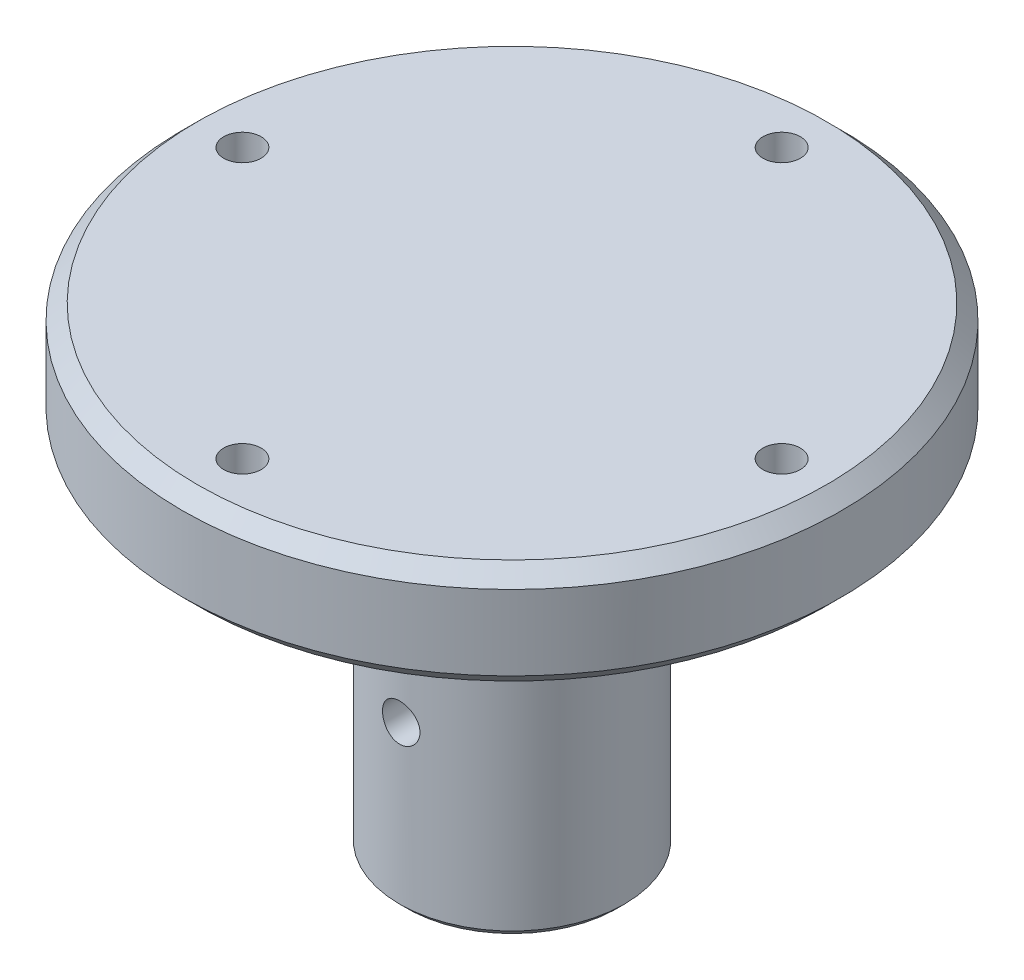
from build123d import *

# Parameters (mm, degrees)
SKETCH_5_R             = 7.5
SKETCH_5_R_2           = 5.25
EXTRUDE_1_DEPTH        = 3.5
SKETCH_6_R             = 1.25
CUT_EXTRUDE_M3_1_DEPTH = 42.856899073
CHAMFER_1_SIZE         = 0.5
CHAMFER_2_SIZE         = 1
CUT_EXTRUDE_14_DEPTH   = 3.5
FILLET_2_R             = 2.25
HOLE_WIZARD_M3_1_D     = 2.5


with BuildPart() as part:
    # 草图1 → 旋转1 (revolve)
    with BuildSketch(Plane(origin=(0, 0, 0), x_dir=(0, 0, -1), z_dir=(1, 0, 0))):
        Polygon((-7.5, 0), (-5.25, 0), (-5.25, 18), (0, 18), (0, 28), (-22, 28), (-22, 21), (-9, 21), (-9, 18), (-7.5, 18), align=None)
    revolve(axis=Axis((0, 28, 0), (0, -1, 0)))

    # 草图5 → 凸台-拉伸1 (add)
    with BuildSketch(Plane.XZ):
        with Locations(Location((0, 0, 0), (0, 0, 90))):
            Circle(SKETCH_5_R)
        with Locations(Location((0, 0, 0), (0, 0, 90))):
            Circle(SKETCH_5_R_2, mode=Mode.SUBTRACT)
    extrude(amount=EXTRUDE_1_DEPTH)

    # 草图6 → M3螺纹孔1 (cut, through all)
    with BuildSketch(Plane.XY):
        with Locations(Location((0, 7.5, 0), (0, 0, 270))):
            Circle(SKETCH_6_R)
    extrude(amount=CUT_EXTRUDE_M3_1_DEPTH, mode=Mode.SUBTRACT)

    # 倒角1
    chamfer_1_edges = [part.edges().sort_by_distance(p)[0] for p in [
        (0, -3.5, -7.5),
        (0, 18, -9),
    ]]
    chamfer(chamfer_1_edges, length=CHAMFER_1_SIZE)

    # 倒角2
    chamfer_2_edges = [part.edges().sort_by_distance(p)[0] for p in [
        (0, 28, -22),
        (0, 21, -22),
    ]]
    chamfer(chamfer_2_edges, length=CHAMFER_2_SIZE)

    # 草图8 → 切除-拉伸14 (cut)
    with BuildSketch(Plane.XZ.offset(-21)):
        with BuildLine():
            Line((-9.866772518, 3.591211505), (-14.095389312, 5.13030215))
            ThreePointArc((-14.095389312, 5.13030215), (0, -15), (14.095389312, 5.13030215))
            Line((14.095389312, 5.13030215), (9.866772518, 3.591211505))
            ThreePointArc((9.866772518, 3.591211505), (0, -10.5), (-9.866772518, 3.591211505))
        make_face()
    extrude(amount=-CUT_EXTRUDE_14_DEPTH, mode=Mode.SUBTRACT)

    # 圆角2
    fillet_2_edges = [part.edges().sort_by_distance(p)[0] for p in [
        (9.866772518, 22.75, 3.591211505),
        (14.095389312, 22.75, 5.13030215),
        (-9.866772518, 22.75, 3.591211505),
        (-14.095389312, 22.75, 5.13030215),
    ]]
    fillet(fillet_2_edges, radius=FILLET_2_R - 0.0001)  # a hair under: the kernel refuses the full size

    # M3 螺纹孔1 (through all)
    with Locations(Plane(origin=(0, 28, -18), x_dir=(0, 0, 1), z_dir=(0, 1, 0))):
        with Locations((0, 0), (18, 18), (36, 0), (18, -18)):
            Hole(HOLE_WIZARD_M3_1_D / 2)


solid = part.part
